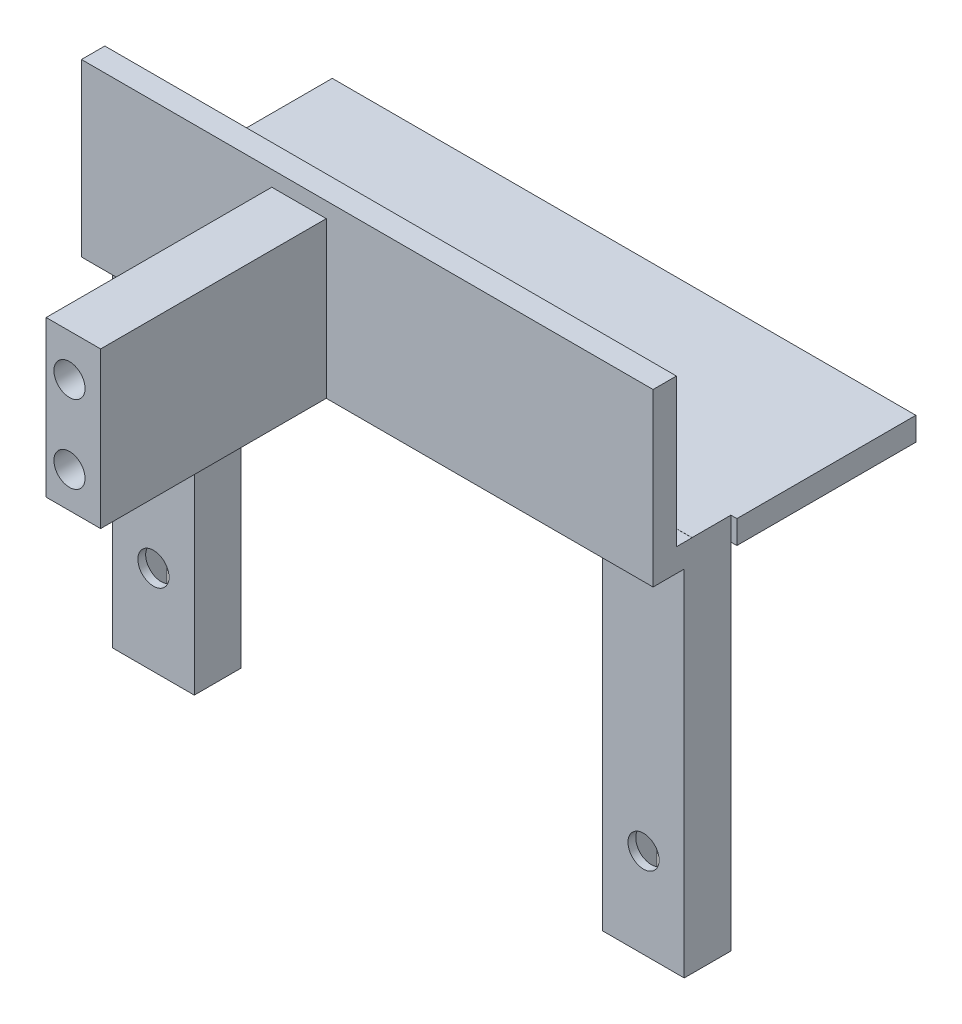
from build123d import *

# Parameters (mm, degrees)
SKETCH1_W            = 75
SKETCH1_H            = 23
BOSS_EXTRUDE1_DEPTH  = 3
BOSS_EXTRUDE4_DEPTH  = 5
SKETCH3_W            = 10.5
SKETCH3_H            = 1
BOSS_EXTRUDE5_DEPTH  = 48.5
SKETCH4_R            = 2
CUT_EXTRUDE1_DEPTH   = 66.282886378
SKETCH8_W            = 73.460514862
SKETCH8_H            = 2.985109538
BOSS_EXTRUDE9_DEPTH  = 10
SKETCH12_W           = 73.460514862
SKETCH12_H           = 3
BOSS_EXTRUDE10_DEPTH = 19
SKETCH13_W           = 7
SKETCH13_H           = 20
BOSS_EXTRUDE11_DEPTH = 29
SKETCH14_R           = 2
CUT_EXTRUDE2_DEPTH   = 10


with BuildPart() as part:
    # Sketch1 → Boss-Extrude1 (new body)
    with BuildSketch(Plane(origin=(0, 0, 0), x_dir=(1, 0, 0), z_dir=(0, 1, 0))):
        Rectangle(SKETCH1_W, SKETCH1_H)
    extrude(amount=BOSS_EXTRUDE1_DEPTH)

    # Sketch2 → Boss-Extrude4 (add)
    with BuildSketch(Plane.XY.offset(11.5)):
        Polygon((27.230257431, 0), (27.230257431, -45.514890462), (26.230257431, -45.514890462), (26.230257431, 3), (36.730257431, 3), (36.730257431, -45.514890462), (35.730257431, -45.514890462), (35.730257431, 0), align=None)
        Polygon((-35.730257431, -45.514890462), (-36.730257431, -45.514890462), (-36.730257431, 3), (-26.230257431, 3), (-26.230257431, -45.514890462), (-27.230257431, -45.514890462), (-27.230257431, 0), (-35.730257431, 0), align=None)
    extrude(amount=BOSS_EXTRUDE4_DEPTH)

    # Sketch3 → Boss-Extrude5 (add)
    with BuildSketch(Plane.XZ.offset(45.514890462)):
        with Locations((-31.480257431, 17)):
            Rectangle(SKETCH3_W, SKETCH3_H)
        with Locations((31.480257431, 17)):
            Rectangle(SKETCH3_W, SKETCH3_H)
    extrude(amount=-BOSS_EXTRUDE5_DEPTH)

    # Sketch4 → Cut-Extrude1 (cut, through all)
    with BuildSketch(Plane(origin=(0, 0, 16.5), x_dir=(-1, 0, 0), z_dir=(0, 0, -1))):
        with Locations((31.481258109, -34.012149814)):
            Circle(SKETCH4_R)
        with Locations((-31.503449984, -34.014890462)):
            Circle(SKETCH4_R)
    extrude(amount=-CUT_EXTRUDE1_DEPTH, mode=Mode.SUBTRACT)

    # Sketch8 → Boss-Extrude9 (add)
    with BuildSketch(Plane.XY.offset(11.5)):
        with Locations((0, 1.492554769)):
            Rectangle(SKETCH8_W, SKETCH8_H)
    extrude(amount=BOSS_EXTRUDE9_DEPTH)

    # Sketch12 → Boss-Extrude10 (add)
    with BuildSketch(Plane(origin=(0, 2.985109538, 0), x_dir=(1, 0, 0), z_dir=(0, 1, 0))):
        with Locations((0, -20)):
            Rectangle(SKETCH12_W, SKETCH12_H)
    extrude(amount=BOSS_EXTRUDE10_DEPTH)

    # Sketch13 → Boss-Extrude11 (add)
    with BuildSketch(Plane.XY.offset(21.5)):
        with Locations((-8.769742569, 10)):
            Rectangle(SKETCH13_W, SKETCH13_H)
    extrude(amount=BOSS_EXTRUDE11_DEPTH)

    # Sketch14 → Cut-Extrude2 (cut)
    with BuildSketch(Plane.XY.offset(50.5)):
        with Locations((-9.269742569, 14.59)):
            Circle(SKETCH14_R)
        with Locations((-9.269742569, 4.59)):
            Circle(SKETCH14_R)
    extrude(amount=-CUT_EXTRUDE2_DEPTH, mode=Mode.SUBTRACT)


solid = part.part
